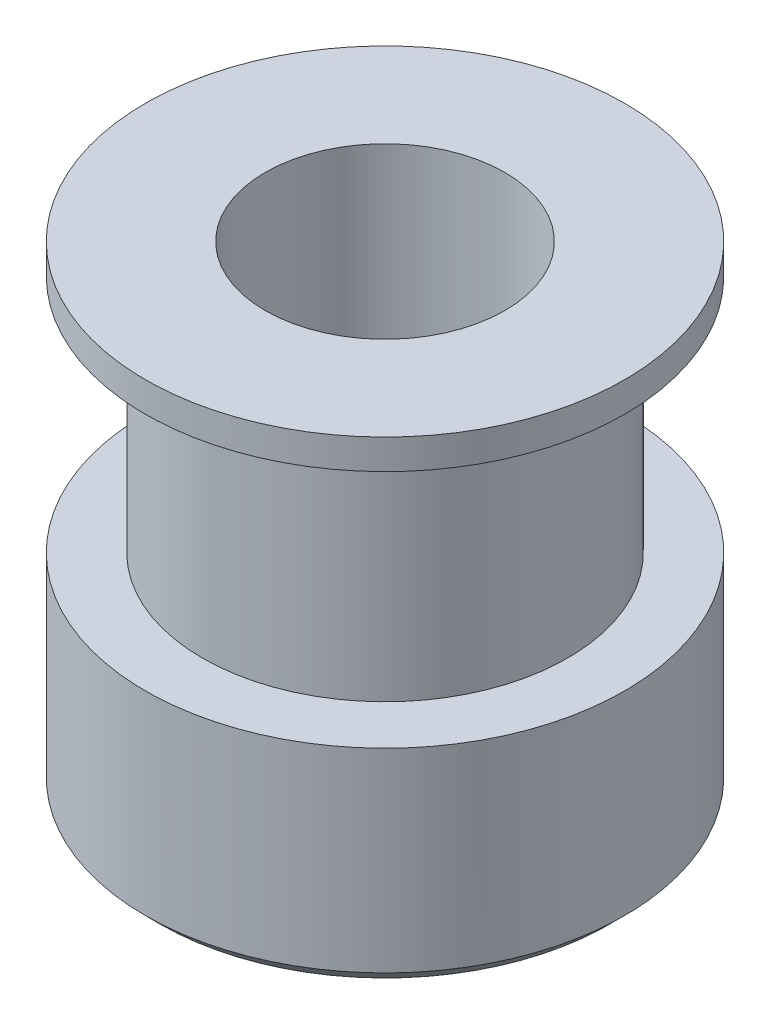
from build123d import *

# Parameters (mm, degrees)
CHAMFER1_SIZE      = 0.5
CUT_EXTRUDE1_REACH = 21.596
SKETCH2_R          = 1.5
CUT_EXTRUDE2_REACH = 21.596
SKETCH3_R          = 1.5


with BuildPart() as part:
    # Sketch1 → Revolve1 (revolve)
    with BuildSketch(Plane.XY):
        Polygon((-4, 0), (-4, 16), (-8, 16), (-8, 15), (-6.1, 15), (-6.1, 7), (-8, 7), (-8, 0), align=None)
    revolve(axis=Axis((0, 0, 0), (0, 1, 0)))

    # Chamfer1
    chamfer1_edges = [part.edges().sort_by_distance(p)[0] for p in [
        (8, 0, 0),
    ]]
    chamfer(chamfer1_edges, length=CHAMFER1_SIZE)

    # Sketch2 → Cut-Extrude1 (cut, up to next)
    with BuildSketch(Plane.XY, mode=Mode.PRIVATE) as cut_extrude1_sk1:
        with Locations((0, 3.5)):
            Circle(SKETCH2_R)
    cut_extrude1_tool1 = extrude(cut_extrude1_sk1.sketch, amount=-CUT_EXTRUDE1_REACH, mode=Mode.PRIVATE) & part.part
    add(cut_extrude1_tool1.solids().sort_by_distance((0, 3.5, 0))[0], mode=Mode.SUBTRACT)

    # Sketch3 → Cut-Extrude2 (cut, up to next)
    with BuildSketch(Plane(origin=(0, 0, 0), x_dir=(0, 0, -1), z_dir=(1, 0, 0)), mode=Mode.PRIVATE) as cut_extrude2_sk1:
        with Locations((0, 3.5)):
            Circle(SKETCH3_R)
    cut_extrude2_tool1 = extrude(cut_extrude2_sk1.sketch, amount=-CUT_EXTRUDE2_REACH, mode=Mode.PRIVATE) & part.part
    add(cut_extrude2_tool1.solids().sort_by_distance((0, 3.5, 0))[0], mode=Mode.SUBTRACT)


solid = part.part
